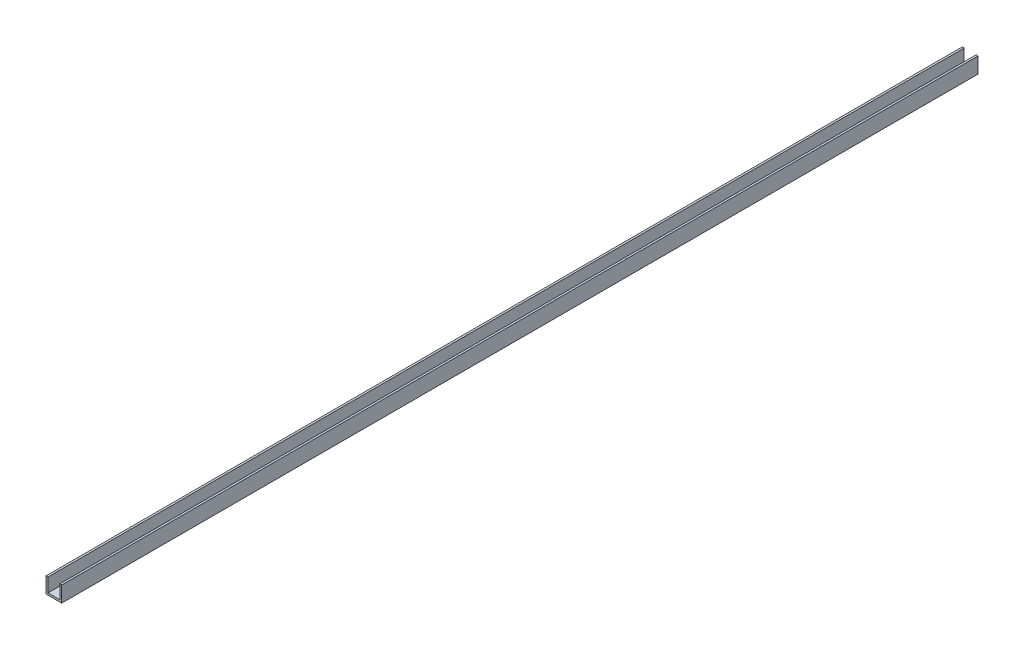
from build123d import *

# Parameters (mm, degrees)
LOFT1_START        = -1479.55
LOFT1_DEPTH        = 1479.55
SKETCH3_R          = 2.4257
CUT_EXTRUDE1_DEPTH = 7.62
LPATTERN1_COUNT    = 11
LPATTERN1_PITCH    = 136.525


# Read off the part's stored shape, not the designer's step: Loft1
with BuildPart() as part:
    # Loft1 outline → Loft1 (new body)
    with BuildSketch(Plane.XY.offset(LOFT1_START)):
        Polygon((0, 0), (0, 25.4), (-3.175, 25.4), (-3.175, 3.175), (-22.225, 3.175), (-22.225, 25.4), (-25.4, 25.4), (-25.4, 0), align=None)
    extrude(amount=LOFT1_DEPTH)

    # Sketch3 → Cut-Extrude1 (cut, symmetric)
    with BuildSketch(Plane(origin=(0, 0, 0), x_dir=(1, 0, 0), z_dir=(0, 1, 0))):
        with Locations(Location((-12.7, 69.85, 0), (0, 0, 270))):
            Circle(SKETCH3_R)
    cut_extrude1 = extrude(amount=CUT_EXTRUDE1_DEPTH, both=True, mode=Mode.SUBTRACT)

    # LPattern1: Cut-Extrude1 ×11
    with Locations(*[(0, 0, -i * LPATTERN1_PITCH) for i in range(1, LPATTERN1_COUNT)]):
        add(cut_extrude1, mode=Mode.SUBTRACT)


solid = part.part
